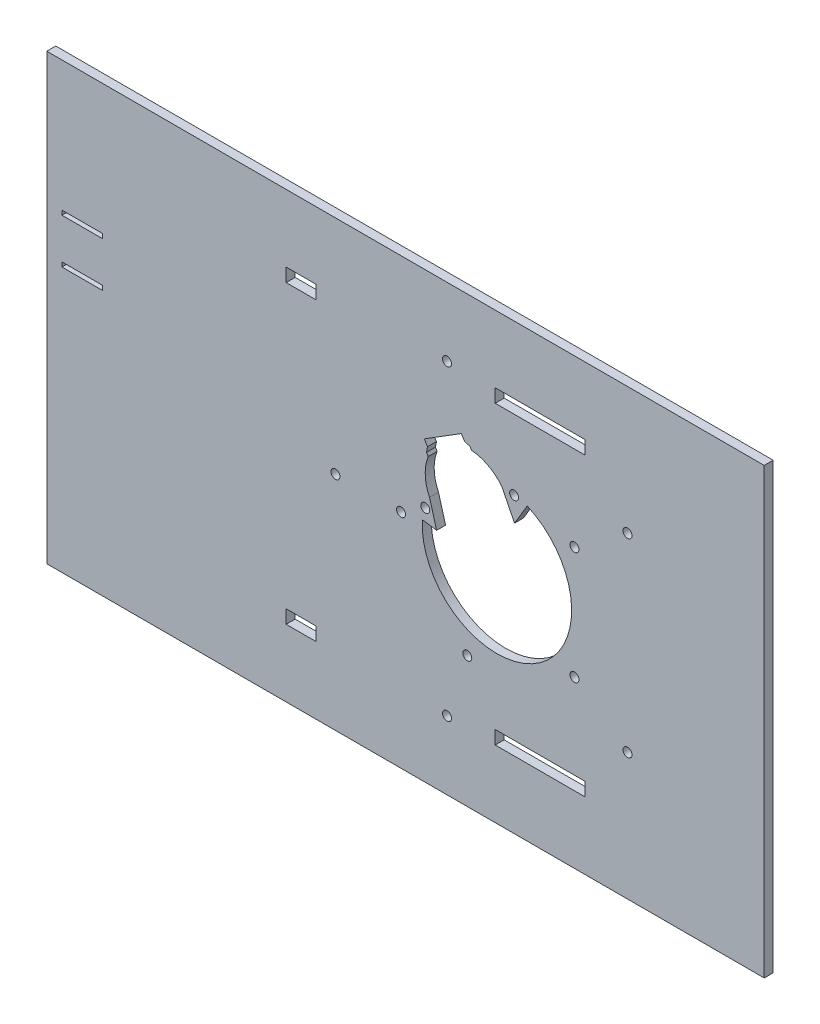
from build123d import *

# Parameters (mm, degrees)
SKETCH1_W           = 240.000854432
SKETCH1_H           = 148.499462854
SKETCH1_R           = 25
SKETCH1_W_2         = 13.501501462
SKETCH1_H_2         = 1.500166829
SKETCH1_H_3         = 1.501200358
SKETCH1_W_3         = 9.930659991
SKETCH1_H_4         = 4.500500488
SKETCH1_W_4         = 29.999719231
SKETCH1_H_5         = 4.500500487
SKETCH1_W_5         = 30.000235995
BOSS_EXTRUDE2_DEPTH = 3
SKETCH5_R           = 1.5
CUT_EXTRUDE4_DEPTH  = 10
SKETCH6_R           = 1.5
CUT_EXTRUDE5_DEPTH  = 10
SKETCH9_R           = 14.5
CUT_EXTRUDE6_DEPTH  = 10
BOSS_EXTRUDE4_START = -3
BOSS_EXTRUDE4_DEPTH = 3
CUT_EXTRUDE7_START  = -3
SKETCH14_R          = 1.5
CUT_EXTRUDE7_DEPTH  = 3
CUT_EXTRUDE8_DEPTH  = 10


with BuildPart() as part:
    # Sketch1 → Boss-Extrude2 (new body)
    with BuildSketch(Plane.XY):
        Rectangle(SKETCH1_W, SKETCH1_H)
        with Locations((30.570227043, 0.001291911)):
            Circle(SKETCH1_R, mode=Mode.SUBTRACT)
        with Locations((-108.180218479, 30.002561435)):
            Rectangle(SKETCH1_W_2, SKETCH1_H_2, mode=Mode.SUBTRACT)
        with Locations((-108.180218479, 15.00037638)):
            Rectangle(SKETCH1_W_2, SKETCH1_H_3, mode=Mode.SUBTRACT)
        with Locations((-34.96659952, 49.499562569)):
            Rectangle(SKETCH1_W_3, SKETCH1_H_4, mode=Mode.SUBTRACT)
        with Locations((44.998545318, 49.499562569)):
            Rectangle(SKETCH1_W_4, SKETCH1_H_4, mode=Mode.SUBTRACT)
        with Locations((-34.96659952, -49.498529041)):
            Rectangle(SKETCH1_W_3, SKETCH1_H_5, mode=Mode.SUBTRACT)
        with Locations((45.000353993, -49.498529041)):
            Rectangle(SKETCH1_W_5, SKETCH1_H_5, mode=Mode.SUBTRACT)
    extrude(amount=BOSS_EXTRUDE2_DEPTH)

    # Sketch5 → Cut-Extrude4 (cut)
    with BuildSketch(Plane.XY.offset(3)):
        with Locations((-23.429772957, 0.001291911)):
            Circle(SKETCH5_R)
        with Locations((13.883309347, 51.358343791)):
            Circle(SKETCH5_R)
        with Locations((74.257144739, 31.741695535)):
            Circle(SKETCH5_R)
        with Locations((74.257144739, -31.739111713)):
            Circle(SKETCH5_R)
        with Locations((13.883309347, -51.355759969)):
            Circle(SKETCH5_R)
    extrude(amount=-CUT_EXTRUDE4_DEPTH, mode=Mode.SUBTRACT)

    # Sketch6 → Cut-Extrude5 (cut)
    with BuildSketch(Plane.XY.offset(3)):
        with Locations((-1.499999444, 0.001291911)):
            Circle(SKETCH6_R)
        with Locations((20.659982045, -30.499305969)):
            Circle(SKETCH6_R)
        with Locations((56.515585284, -18.849114256)):
            Circle(SKETCH6_R)
        with Locations((56.515585284, 18.851698077)):
            Circle(SKETCH6_R)
    extrude(amount=-CUT_EXTRUDE5_DEPTH, mode=Mode.SUBTRACT)

    # Sketch9 → Cut-Extrude6 (cut)
    with BuildSketch(Plane.XY.offset(3)):
        with Locations((21.045979743, 15.275083626)):
            Circle(SKETCH9_R)
    extrude(amount=-CUT_EXTRUDE6_DEPTH, mode=Mode.SUBTRACT)

    # Sketch13 → Boss-Extrude4 (add)
    with BuildSketch(Plane.XY.offset(3).offset(BOSS_EXTRUDE4_START)):
        with BuildLine():
            ThreePointArc((8.029540278, 9.039543161), (13.320857472, 27.50368773), (32.244528482, 24.214714051))
            Line((32.244528482, 24.214714051), (36.464610708, 15.736563351))
            Line((36.464610708, 15.736563351), (40.711520565, 22.851984804))
            ThreePointArc((40.711520565, 22.851984804), (39.274340999, 23.437127724), (37.803627931, 23.931981654))
            ThreePointArc((37.803627931, 23.931981654), (37.809425032, 23.856031132), (37.811359061, 23.779884249))
            ThreePointArc((37.811359061, 23.779884249), (35.885746907, 22.341533007), (35.052886669, 24.596123943))
            ThreePointArc((35.052886669, 24.596123943), (33.446845248, 24.835241812), (31.828668886, 24.969598304))
            ThreePointArc((31.828668886, 24.969598304), (13.373669418, 27.578971397), (7.59561948, 9.858644869))
            ThreePointArc((7.59561948, 9.858644869), (6.996783678, 8.325519677), (6.500127519, 6.756312925))
            ThreePointArc((6.500127519, 6.756312925), (7.632543085, 6.360125371), (8.112319615, 5.260514498))
            ThreePointArc((8.112319615, 5.260514498), (7.373043787, 3.967727302), (5.883921303, 3.949241872))
            ThreePointArc((5.883921303, 3.949241872), (5.710880965, 2.649482347), (5.606226413, 1.342437892))
            Line((5.606226413, 1.342437892), (10.396423525, 0.623978449))
            Line((10.396423525, 0.623978449), (8.029540278, 9.039543161))
        make_face()
    extrude(amount=BOSS_EXTRUDE4_DEPTH)

    # Sketch14 → Cut-Extrude7 (cut)
    with BuildSketch(Plane.XY.offset(3).offset(CUT_EXTRUDE7_START)):
        with Locations((36.311359061, 23.779884249)):
            Circle(SKETCH14_R)
        with Locations((6.612319615, 5.260514498)):
            Circle(SKETCH14_R)
    extrude(amount=CUT_EXTRUDE7_DEPTH, mode=Mode.SUBTRACT)

    # Sketch15 → Cut-Extrude8 (cut)
    with BuildSketch(Plane(origin=(0, 0, 0), x_dir=(-1, 0, 0), z_dir=(0, 0, -1))):
        Polygon((-21.528245438, 30.572462848), (-19.747842115, 31.065258696), (-18.661087972, 32.80805851), (-6.272345803, 25.082835699), (-7.359099946, 23.340035886), (-7.018143308, 21.524427913), (-7.679549371, 20.463747933), (-22.1896515, 29.511782868), align=None)
    extrude(amount=-CUT_EXTRUDE8_DEPTH, mode=Mode.SUBTRACT)


solid = part.part
